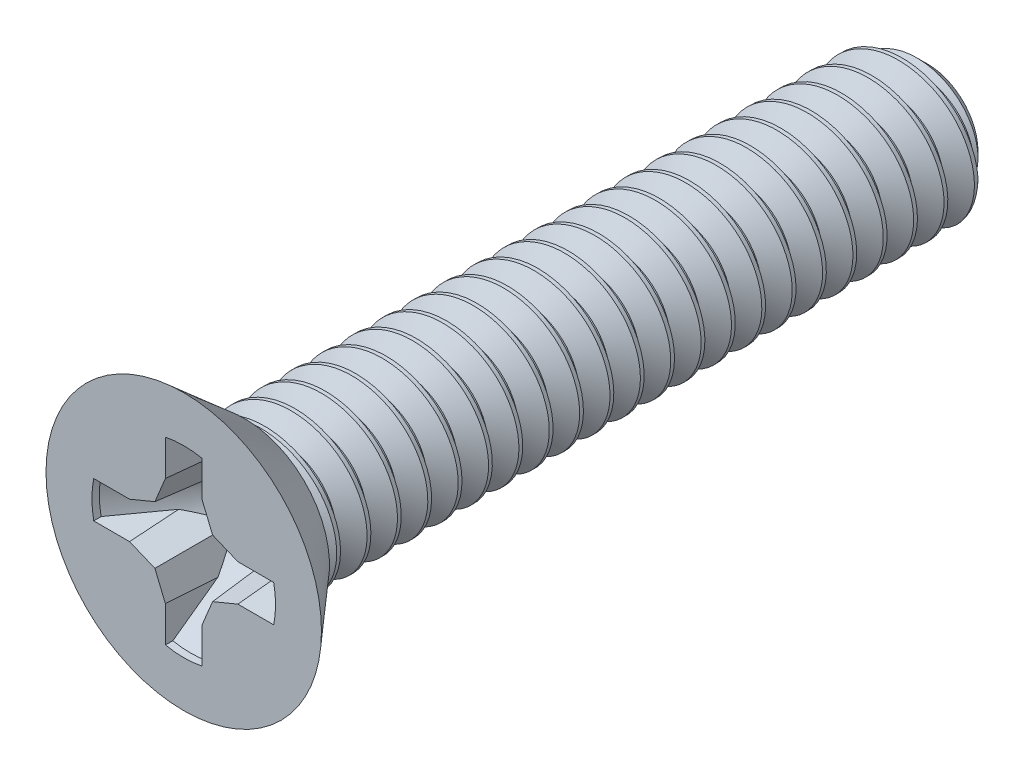
from build123d import *

# Parameters (mm, degrees)
CUT_EXTRUDE2_REACH     = 13.487
CIRPATTERN1_COUNT      = 4
DRAFT2_ANGLE           = 5
SPLIT1_SURFACE_1_BACK  = 13.544
SPLIT1_SURFACE_1_DEPTH = 27.088
SPLIT1_SURFACE_2_BACK  = 13.544
SPLIT1_SURFACE_2_DEPTH = 27.088
CUT_SWEEP1_PITCH       = 0.453571429
CUT_SWEEP1_TO          = 10.1981


with BuildPart() as part:
    # Sketch3 → Revolve1 (revolve)
    with BuildSketch(Plane(origin=(0, 0, 0), x_dir=(0, 0, -1), z_dir=(1, 0, 0)), mode=Mode.PRIVATE) as revolve1_sk:
        Polygon((5.55625, 0.752021429), (5.216071429, 1.0922), (-4.64185, 1.0922), (-4.64185, 1.262524207), (-5.55625, 2.0574), (-5.55625, 0), (5.55625, 0), align=None)
    revolve(revolve1_sk.sketch.rotate(Axis((0, 0, -5.55625), (0, 0, 1)), 90), axis=Axis((0, 0, -5.55625), (0, 0, 1)))

    # Cut-Extrude2: up to this cone (the profile starts inside it)
    cut_extrude2_end = Plane(origin=(0, 0, 5.55625), z_dir=(0, 0, 1)).offset(-1.66987845) * Cone(1e-06, 14.872177819, 17.108482509, align=(Align.CENTER, Align.CENTER, Align.MIN), mode=Mode.PRIVATE)
    # Sketch7 → Cut-Extrude2 (cut, up to the surface)
    with BuildSketch(Plane.XY.offset(5.55625), mode=Mode.PRIVATE) as cut_extrude2_sk1:
        with BuildLine():
            Line((1.343888052, 0.27432), (0.809104026, 0.27432))
            Line((0.809104026, 0.27432), (0.430954615, 0.430954615))
            Line((0.430954615, 0.430954615), (0.27432, 0.809104026))
            Line((0.27432, 0.809104026), (0.27432, 1.343888052))
            ThreePointArc((0.27432, 1.343888052), (0.137858092, 1.364654427), (0, 1.3716))
            Line((0, 1.3716), (0, 0))
            Line((0, 0), (1.3716, 0))
            ThreePointArc((1.3716, 0), (1.364654427, 0.137858092), (1.343888052, 0.27432))
        make_face()
    cut_extrude2_tool1 = extrude(cut_extrude2_sk1.sketch, amount=-CUT_EXTRUDE2_REACH, mode=Mode.PRIVATE) & cut_extrude2_end
    cut_extrude2 = cut_extrude2_tool1.solids().sort_by_distance((1.076496, 0.254923, 5.55625))[0]
    add(cut_extrude2, mode=Mode.SUBTRACT)

    # CirPattern1: Cut-Extrude2 ×4 about axis
    cirpattern1_axis = Axis((0, 0, 0), (0, 0, 1))
    for i in range(1, CIRPATTERN1_COUNT):
        add(cut_extrude2.rotate(cirpattern1_axis, i * 360 / CIRPATTERN1_COUNT), mode=Mode.SUBTRACT)

    # Draft3: read off the stored shape, not the designer's step
    # Draft3 outline → Draft3 (revolve)
    with BuildSketch(Plane.XZ):
        Polygon((1.3716, 5.55625), (1.362646987, 5.453916593), (1.3716, 5.453916593), align=None)
    revolve(axis=Axis((0, 0, 0), (0, 0, 1)))

    # Draft2
    draft2_faces = [part.faces().sort_by_distance(p)[0] for p in [
        (-1.007981804, 0.27432, 5.322556616),
        (-0.609379862, 0.357048458, 5.131098181),
        (-0.357048458, 0.609379862, 5.131098181),
        (-0.27432, 1.007981814, 5.322556636),
        (0.27432, 1.007981804, 5.322556616),
        (0.357048458, 0.609379862, 5.131098181),
        (0.609379862, 0.357048458, 5.131098181),
        (1.007981814, 0.27432, 5.322556636),
        (1.007981804, -0.27432, 5.322556616),
        (0.609379862, -0.357048458, 5.131098181),
        (0.357048458, -0.609379862, 5.131098181),
        (0.27432, -1.007981814, 5.322556636),
        (-0.27432, -1.007981804, 5.322556616),
        (-0.357048458, -0.609379862, 5.131098181),
        (-0.609379862, -0.357048458, 5.131098181),
        (-1.007981814, -0.27432, 5.322556636),
    ]]
    draft(draft2_faces, Plane(origin=(0, 2.0574, 5.55625), x_dir=(1, 0, 0), z_dir=(0, 0, 1)), DRAFT2_ANGLE)


with BuildPart() as body_2:
    # Split1: the piece behind the surface
    add(part.part)
    # Split1 surface: a surface, the sketch's curves swept straight by 27.088 mm
    with BuildLine(Plane(origin=(0, 0, 0), x_dir=(0, 0, -1), z_dir=(1, 0, 0)).offset(-SPLIT1_SURFACE_1_BACK), mode=Mode.PRIVATE) as split1_surface_1_path:
        Line((-4.64185, 1.262524207), (-4.64185, -1.262524207))
    split1_surface_1 = Shell.extrude(split1_surface_1_path.wire(), (1 * SPLIT1_SURFACE_1_DEPTH, 0 * SPLIT1_SURFACE_1_DEPTH, 0 * SPLIT1_SURFACE_1_DEPTH))
    split(bisect_by=split1_surface_1, keep=Keep.BOTTOM)


with BuildPart() as part_1:
    add(part.part)

    # Split1: split by a surface, the side it looks to stays
    # Split1 surface: a surface, the sketch's curves swept straight by 27.088 mm
    with BuildLine(Plane(origin=(0, 0, 0), x_dir=(0, 0, -1), z_dir=(1, 0, 0)).offset(-SPLIT1_SURFACE_2_BACK), mode=Mode.PRIVATE) as split1_surface_2_path:
        Line((-4.64185, 1.262524207), (-4.64185, -1.262524207))
    split1_surface_2 = Shell.extrude(split1_surface_2_path.wire(), (1 * SPLIT1_SURFACE_2_DEPTH, 0 * SPLIT1_SURFACE_2_DEPTH, 0 * SPLIT1_SURFACE_2_DEPTH))
    split(bisect_by=split1_surface_2, keep=Keep.TOP)

    # Cut-Sweep1: arcs per turn and ends read off the stored shape
    # Cut-Sweep1: the profile of Sketch6 screwed along a right-hand helix through 24.5 turns, 6 arcs to a turn; built about Z, then put on its axis
    cut_sweep1_z = Axis((0, 0, 0), (0, 0, 1))
    cut_sweep1_corners = [(0.797596715, 0, -0.170089286), (1.116750274, 0, 0.014174107), (1.116750274, 0, -0.411049107), (0.797596715, 0, -0.226785714)]
    with BuildLine(mode=Mode.PRIVATE) as cut_sweep1_profile:
        Line(cut_sweep1_corners[0], cut_sweep1_corners[1])
        Line(cut_sweep1_corners[1], cut_sweep1_corners[2])
        Line(cut_sweep1_corners[2], cut_sweep1_corners[3])
        Line(cut_sweep1_corners[3], cut_sweep1_corners[0])
    cut_sweep1_cap = Face(cut_sweep1_profile.wire())
    cut_sweep1_turn_angles = [0, 30, 60, 90, 120, 150, 180, 210, 240, 270, 300, 330, 360]
    cut_sweep1_turn_weights = [1, 0.8660254037844387, 1, 0.8660254037844387, 1, 0.8660254037844387, 1, 0.8660254037844387, 1, 0.8660254037844387, 1, 0.8660254037844387, 1]
    cut_sweep1_turn_rails = [Edge.make_bspline([Vector(p[0], p[1], 0).rotate(cut_sweep1_z, cut_sweep1_turn_angles[k]) / cut_sweep1_turn_weights[k] + Vector(0, 0, p[2] + CUT_SWEEP1_PITCH * cut_sweep1_turn_angles[k] / 360) for k in range(13)], [0, 0, 0, 1, 1, 2, 2, 3, 3, 4, 4, 5, 5, 6, 6, 6], 2, cut_sweep1_turn_weights) for p in cut_sweep1_corners]
    cut_sweep1_turn_sides = [Face.make_surface_from_curves(cut_sweep1_turn_rails[p[0]], cut_sweep1_turn_rails[p[1]]) for p in [(0, 1), (1, 2), (2, 3), (3, 0)]]
    cut_sweep1_last_angles = [8640, 8670, 8700, 8730, 8760, 8790, 8820]
    cut_sweep1_last_weights = [1, 0.8660254037844387, 1, 0.8660254037844387, 1, 0.8660254037846767, 1]
    cut_sweep1_last_rails = [Edge.make_bspline([Vector(p[0], p[1], 0).rotate(cut_sweep1_z, cut_sweep1_last_angles[k]) / cut_sweep1_last_weights[k] + Vector(0, 0, p[2] + CUT_SWEEP1_PITCH * cut_sweep1_last_angles[k] / 360) for k in range(7)], [0, 0, 0, 1, 1, 2, 2, 3, 3, 3], 2, cut_sweep1_last_weights) for p in cut_sweep1_corners]
    cut_sweep1_last_sides = [Face.make_surface_from_curves(cut_sweep1_last_rails[p[0]], cut_sweep1_last_rails[p[1]]) for p in [(0, 1), (1, 2), (2, 3), (3, 0)]]
    cut_sweep1 = Plane(origin=(0, 0, -5.55625), x_dir=(0, 1, 0), z_dir=(0, 0, 1)) * split(Solid(Shell([*[p.moved(Location((0, 0, CUT_SWEEP1_PITCH * i))) for i in range(24) for p in cut_sweep1_turn_sides], *cut_sweep1_last_sides, cut_sweep1_cap, cut_sweep1_cap.rotate(cut_sweep1_z, 8820).moved(Location((0, 0, CUT_SWEEP1_PITCH * 8820 / 360)))])), bisect_by=Plane.XY.offset(CUT_SWEEP1_TO), keep=Keep.BOTTOM, mode=Mode.PRIVATE)
    add(cut_sweep1, mode=Mode.SUBTRACT)


with BuildPart() as body_2_1:
    add(body_2.part)

    # Combine1: union part
    add(part_1.part)


solid = body_2_1.part
